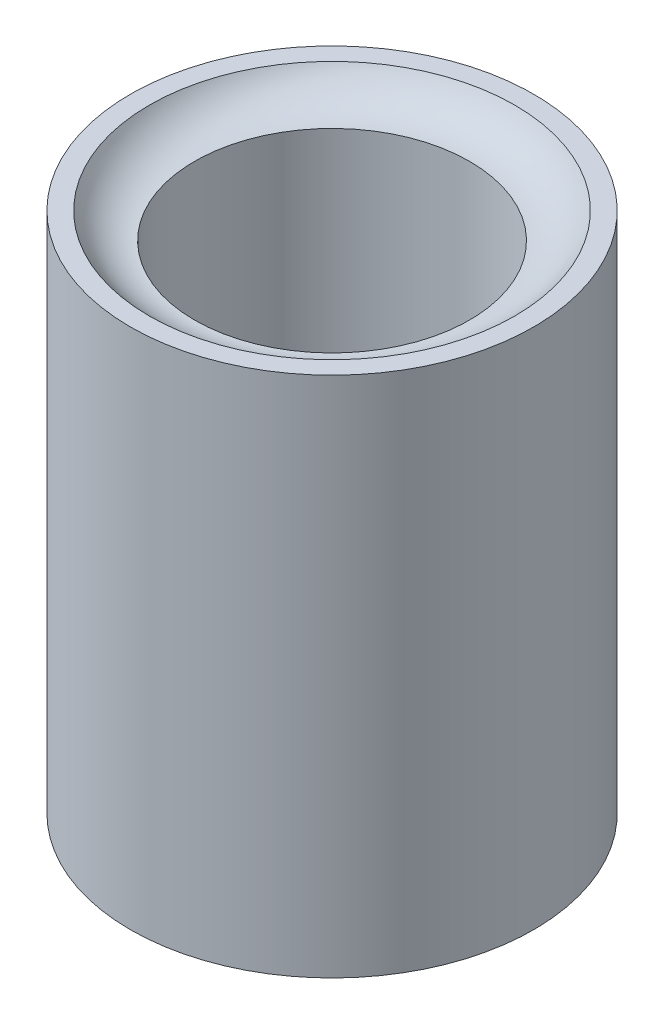
from build123d import *

# Parameters (mm, degrees)
SKETCH_1_R          = 38.625
EXTRUDE_1_DEPTH     = 100
SKETCH_2_R          = 35
CUT_EXTRUDE_3_DEPTH = 5
FILLET_8_R          = 10
SKETCH_4_R          = 26.339745962
CUT_EXTRUDE_4_DEPTH = 97.665379301


with BuildPart() as part:
    # 草圖1 → 填料-伸長1 (new body)
    with BuildSketch(Plane(origin=(0, 0, 0), x_dir=(1, 0, 0), z_dir=(0, 1, 0))):
        with Locations(Location((0, 0, 0), (0, 0, 270))):
            Circle(SKETCH_1_R)
    extrude(amount=EXTRUDE_1_DEPTH)

    # 草圖2 → 除料-伸長3 (cut)
    with BuildSketch(Plane(origin=(0, 100, 0), x_dir=(1, 0, 0), z_dir=(0, 1, 0))):
        with Locations(Location((0, 0, 0), (0, 0, 270))):
            Circle(SKETCH_2_R)
    extrude(amount=-CUT_EXTRUDE_3_DEPTH, mode=Mode.SUBTRACT)

    # 圓角8
    # the kernel refuses this fillet: 10 mm, written as the material it adds along each edge
    with BuildSketch(Plane(origin=(0, 95, 0), x_dir=(0, 0, 1), z_dir=(-1, 0, 0))) as fillet_8_piece_1:
        with BuildLine():
            CenterArc((26.339745962, 10), FILLET_8_R, 270, 60)
            Line((26.339745962, 0), (26.339745962, -0.2))
            Line((26.339745962, -0.2), (35, -0.2))
            Line((35, -0.2), (35.2, 0))
            ThreePointArc((35.2, 0), (35.2, 2.5), (35.173205081, 4.9))
            Line((35.173205081, 4.9), (35, 5))
        make_face()
    revolve(axis=Axis((0, 95, 0), (0, 1, 0)))

    # 草圖4 → 除料-伸長4 (cut)
    with BuildSketch(Plane(origin=(0, 95, 0), x_dir=(1, 0, 0), z_dir=(0, 1, 0))):
        with Locations(Location((0, 0, 0), (0, 0, 270))):
            Circle(SKETCH_4_R)
    extrude(amount=-CUT_EXTRUDE_4_DEPTH, mode=Mode.SUBTRACT)


solid = part.part
